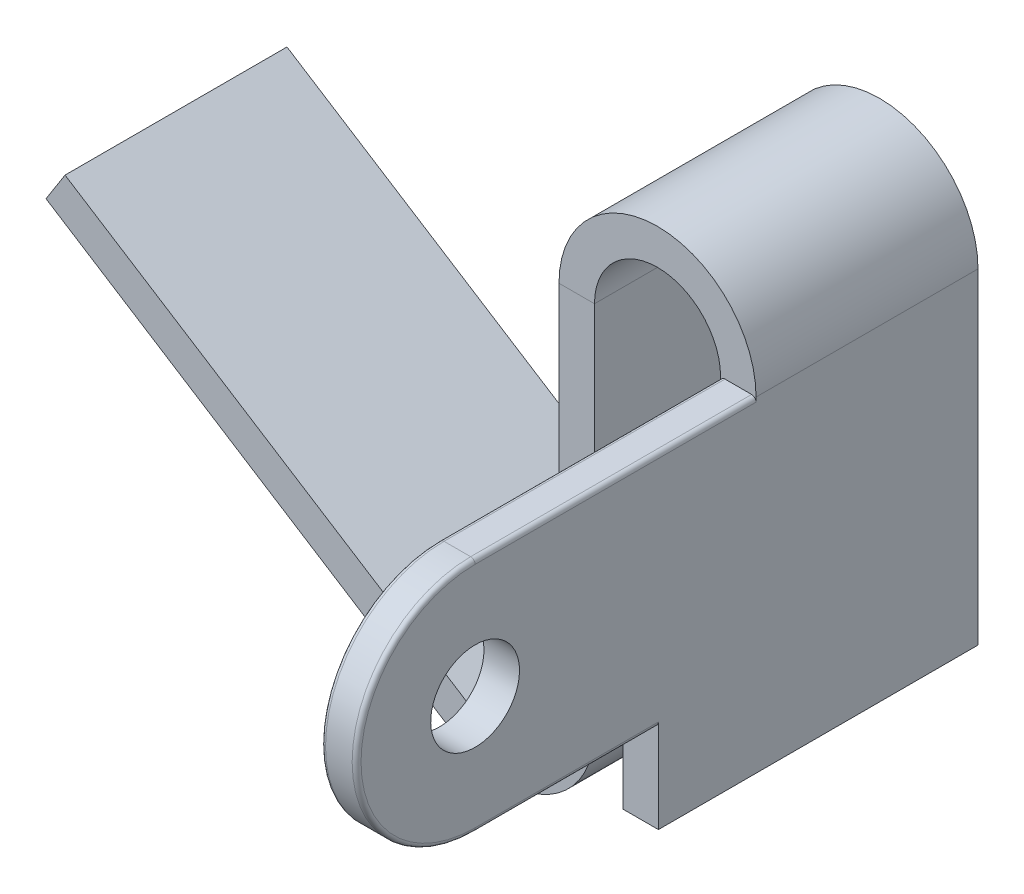
from build123d import *

# Parameters (mm, degrees)
BASE_FLANGE1_DEPTH  = 2.5
SKETCH6_W           = 0.4
SKETCH6_H           = 3.67
BOSS_EXTRUDE1_DEPTH = 4.5
SKETCH7_W           = 3.4
SKETCH7_H           = 1
CUT_EXTRUDE1_DEPTH  = 4.5
FILLET1_RADIUS      = 1.335
FILLET1_LENGTH      = 0.4
FILLET2_R           = 0.05
CUT_EXTRUDE2_REACH  = 13.14
SKETCH8_R           = 0.5
SCALE1_SCALE        = 0.445


# Sheet-metal steps are written as plain solids
with BuildPart() as part:
    # Sketch1 → Base-Flange1 (new body)
    with BuildSketch(Plane.XY):
        with BuildLine():
            Line((0.71, -1.835), (0.71, 1.835))
            ThreePointArc((0.71, 1.835), (0, 2.545), (-0.71, 1.835))
            Line((-0.71, 1.835), (-0.71, -2.335))
            ThreePointArc((-0.71, -2.335), (-1.228475759, -3.211432773), (-2.246268811, -3.179047252))
            Line((-2.246268811, -3.179047252), (-6.888528694, -0.229568793))
            Line((-6.888528694, -0.229568793), (-6.67402117, 0.108050107))
            Line((-6.67402117, 0.108050107), (-2.031761286, -2.841428351))
            ThreePointArc((-2.031761286, -2.841428351), (-1.421085455, -2.860859664), (-1.11, -2.335))
            Line((-1.11, -2.335), (-1.11, 1.835))
            ThreePointArc((-1.11, 1.835), (0, 2.945), (1.11, 1.835))
            Line((1.11, 1.835), (1.11, -1.835))
            Line((1.11, -1.835), (0.71, -1.835))
        make_face()
    extrude(amount=BASE_FLANGE1_DEPTH)

    # Sketch6 → Boss-Extrude1 (add)
    with BuildSketch(Plane.XY.offset(2.5)):
        with Locations((0.91, 0)):
            Rectangle(SKETCH6_W, SKETCH6_H)
    extrude(amount=BOSS_EXTRUDE1_DEPTH)

    # Sketch7 → Cut-Extrude1 (cut)
    with BuildSketch(Plane(origin=(1.11, 0, 0), x_dir=(0, 0, -1), z_dir=(1, 0, 0))):
        with Locations((-5.3, -1.335)):
            Rectangle(SKETCH7_W, SKETCH7_H)
    extrude(amount=-CUT_EXTRUDE1_DEPTH, mode=Mode.SUBTRACT)

    # Fillet1: full round fillet: the end face becomes a half cylinder, R = half its width
    fillet1_face = Plane((0.91, 0.5, 7), x_dir=(-1, 0, 0), z_dir=(0, 0, 1))  # on the end face: x along it, z out of the body
    fillet1_slab = fillet1_face.offset(-FILLET1_RADIUS / 2) * Box(FILLET1_LENGTH, 2 * FILLET1_RADIUS, FILLET1_RADIUS, mode=Mode.PRIVATE)  # the body's end, R deep
    fillet1_round = Plane((0.91, 0.5, 5.665), x_dir=(0, 0, 1), z_dir=(-1, 0, 0)) * Cylinder(FILLET1_RADIUS, FILLET1_LENGTH, mode=Mode.PRIVATE)  # its axis R under the face
    add(fillet1_slab - fillet1_round, mode=Mode.SUBTRACT)

    # Fillet2
    fillet2_edges = [part.edges().sort_by_distance(p)[0] for p in [
        (0.71, -0.835, 4.6325),
        (1.11, -0.835, 4.6325),
        (0.71, 1.835, 4.0825),
        (1.11, 1.835, 4.0825),
        (1.11, 0.5, 7),
        (0.71, 0.5, 7),
    ]]
    fillet(fillet2_edges, radius=FILLET2_R)

    # Sketch8 → Cut-Extrude2 (cut, up to next)
    with BuildSketch(Plane(origin=(1.11, 0, 0), x_dir=(0, 0, -1), z_dir=(1, 0, 0)), mode=Mode.PRIVATE) as cut_extrude2_sk1:
        with Locations(Location((-5.665, 0.5, 0), (0, 0, 90))):
            Circle(SKETCH8_R)
    cut_extrude2_tool1 = extrude(cut_extrude2_sk1.sketch, amount=-CUT_EXTRUDE2_REACH, mode=Mode.PRIVATE) & part.part
    add(cut_extrude2_tool1.solids().sort_by_distance((1.11, 0.5, 5.665))[0], mode=Mode.SUBTRACT)


with BuildPart() as part_1:
    # Scale1: scaled about (-1.02810541, -0.268832407, 1.894523092)
    add(part.part.scale(SCALE1_SCALE).moved(Location((-0.570598503, -0.149201986, 1.051460316))))


solid = part_1.part
